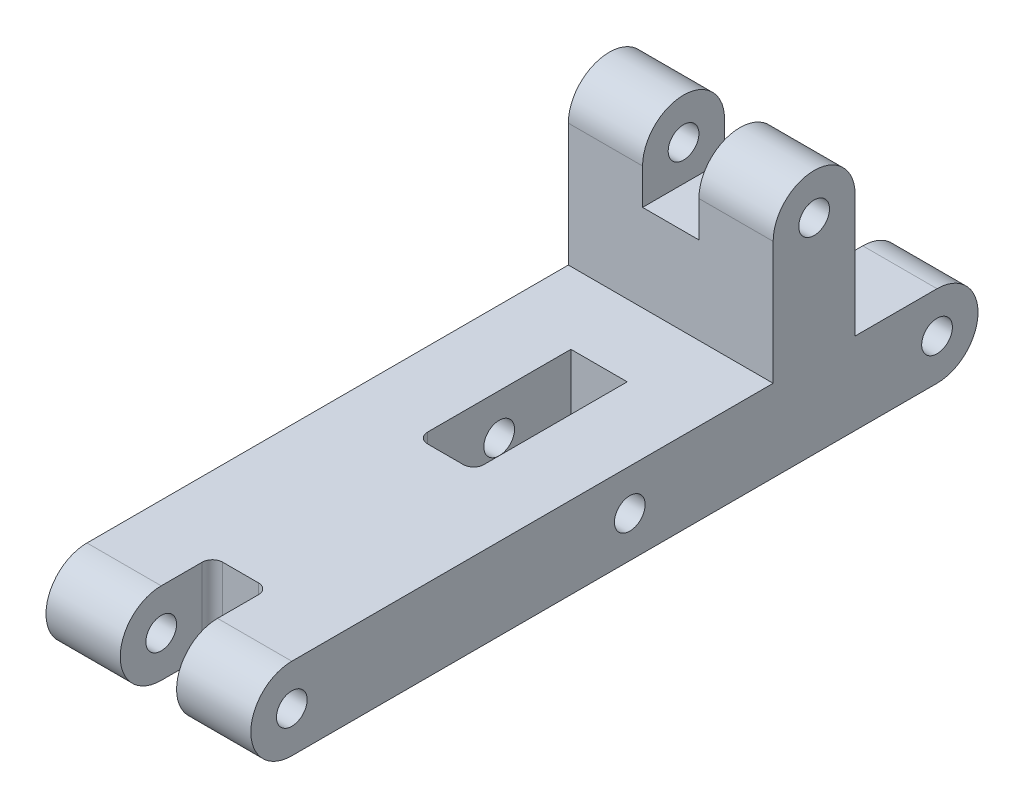
from build123d import *

# Parameters (mm, degrees)
CROQUIS1_R              = 1.5
SALIENTE_EXTRUIR1_DEPTH = 10
CROQUIS2_W              = 8
CROQUIS2_H              = 7.5
CROQUIS2_W_2            = 15
CROQUIS2_H_2            = 8
CROQUIS2_W_3            = 9
CORTAR_EXTRUIR1_DEPTH   = 2.75
REDONDEO1_R             = 1


with BuildPart() as part:
    # Croquis1 → Saliente-Extruir1 (new, symmetric)
    with BuildSketch(Plane(origin=(0, 0, 0), x_dir=(0, 0, -1), z_dir=(1, 0, 0))):
        with BuildLine():
            Line((-15, 4), (-1, 4))
            Line((-1, 4), (-1, 16))
            ThreePointArc((-1, 16), (3, 20), (7, 16))
            Line((7, 16), (7, 4))
            Line((7, 4), (15, 4))
            ThreePointArc((15, 4), (19, 0), (15, -4))
            Line((15, -4), (-15, -4))
            Line((-15, -4), (-48, -4))
            ThreePointArc((-48, -4), (-52, 0), (-48, 4))
            Line((-48, 4), (-15, 4))
        make_face()
        with Locations((15, 0)):
            Circle(CROQUIS1_R, mode=Mode.SUBTRACT)
        with Locations((3, 16)):
            Circle(CROQUIS1_R, mode=Mode.SUBTRACT)
        with Locations((-15, 0)):
            Circle(CROQUIS1_R, mode=Mode.SUBTRACT)
        with Locations((-48, 0)):
            Circle(CROQUIS1_R, mode=Mode.SUBTRACT)
    extrude(amount=SALIENTE_EXTRUIR1_DEPTH, both=True)

    # Croquis2 → Cortar-Extruir1 (cut, symmetric)
    with BuildSketch(Plane(origin=(0, 0, 0), x_dir=(0, 0, -1), z_dir=(1, 0, 0))):
        with Locations((3, 16.25)):
            Rectangle(CROQUIS2_W, CROQUIS2_H)
        with Locations((-15.5, 0)):
            Rectangle(CROQUIS2_W_2, CROQUIS2_H_2)
        with Locations((14.5, 0)):
            Rectangle(CROQUIS2_W_3, CROQUIS2_H_2)
        with Locations((-47.5, 0)):
            Rectangle(CROQUIS2_W_3, CROQUIS2_H_2)
    extrude(amount=CORTAR_EXTRUIR1_DEPTH, both=True, mode=Mode.SUBTRACT)

    # Redondeo1
    redondeo1_edges = [part.edges().sort_by_distance(p)[0] for p in [
        (2.75, 0, 23),
        (-2.75, 0, 23),
        (2.75, 0, 43),
        (-2.75, 0, 43),
        (2.75, 0, -10),
        (-2.75, 0, -10),
    ]]
    fillet(redondeo1_edges, radius=REDONDEO1_R)


solid = part.part
